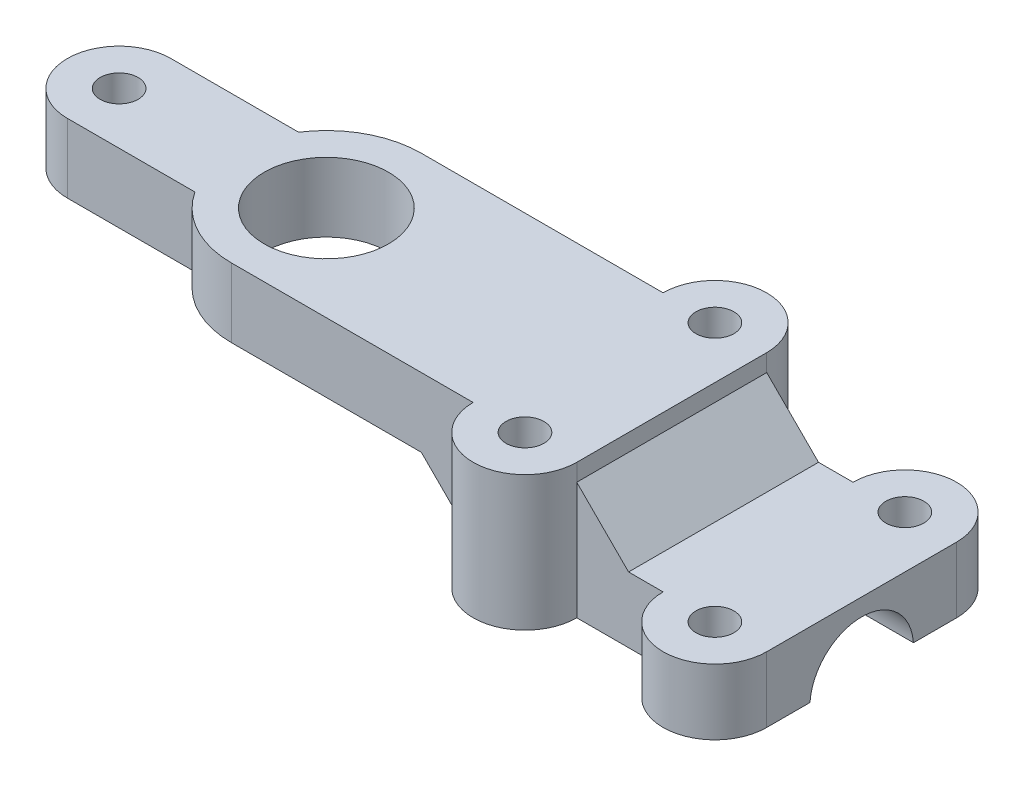
from build123d import *

# Parameters (mm, degrees)
SKETCH_1_R              = 3
SKETCH_1_R_2            = 1.1
SKETCH_1_R_3            = 5.5
SKETCH_1_R_4            = 3.6
EXTRUDE_1_DEPTH         = 4
EXTRUDE_START           = 4
SKETCH_2_R              = 1.1
EXTRUDE_2_DEPTH         = 4
CHAMFER_1_SIZE          = 3
SKETCH_3_R              = 3
CUT_EXTRUDE_1_DEPTH     = 12
SKETCH_4_R              = 1
CUT_EXTRUDE_2_DEPTH     = 12
CHAMFER_2_SIZE          = 0.2
CUT_EXTRUDE_START       = -0.2
CUT_EXTRUDE_3_OUTLINE_R = 1.1
CUT_EXTRUDE_3_DEPTH     = 0.2


with BuildPart() as part:
    # 草图1 → 凸台-拉伸1 (new body)
    # profile 1 of 12: a face of its own
    with BuildSketch(Plane(origin=(0, 0, 0), x_dir=(1, 0, 0), z_dir=(0, 1, 0))):
        Circle(SKETCH_1_R)
        with Locations(Location((0, 0, 0), (0, 0, 270))):
            Circle(SKETCH_1_R_2, mode=Mode.SUBTRACT)
    # profile 2 of 12: a face of its own
    with BuildSketch(Plane(origin=(0, 0, 0), x_dir=(1, 0, 0), z_dir=(0, 1, 0))):
        with BuildLine():
            Line((7.390227771, 3), (0, 3))
            ThreePointArc((0, 3), (2.121320344, 2.121320344), (3, 0))
            ThreePointArc((3, 0), (2.121320344, -2.121320344), (0, -3))
            Line((0, -3), (7.390227771, -3))
            ThreePointArc((7.390227771, -3), (6.5, 0), (7.390227771, 3))
        make_face()
    # profile 3 of 12: a face of its own
    with BuildSketch(Plane(origin=(0, 0, 0), x_dir=(1, 0, 0), z_dir=(0, 1, 0))):
        with Locations((12, 0)):
            Circle(SKETCH_1_R_3)
        with Locations(Location((12, 0, 0), (0, 0, 270))):
            Circle(SKETCH_1_R_4, mode=Mode.SUBTRACT)
    # profile 4 of 12: a face of its own
    with BuildSketch(Plane(origin=(0, 0, 0), x_dir=(1, 0, 0), z_dir=(0, 1, 0))):
        with BuildLine():
            Line((26, 5.5), (12, 5.5))
            ThreePointArc((12, 5.5), (15.889087297, 3.889087297), (17.5, 0))
            ThreePointArc((17.5, 0), (15.889087297, -3.889087297), (12, -5.5))
            Line((12, -5.5), (26, -5.5))
            ThreePointArc((26, -5.5), (29, -2.5), (32, -5.5))
            Line((32, -5.5), (32, 5.5))
            ThreePointArc((32, 5.5), (29, 2.5), (26, 5.5))
        make_face()
    # profile 5 of 12: a face of its own
    with BuildSketch(Plane(origin=(0, 0, 0), x_dir=(1, 0, 0), z_dir=(0, 1, 0))):
        with BuildLine():
            ThreePointArc((32, 5.5), (29, 8.5), (26, 5.5))
            Line((26, 5.5), (27.9, 5.5))
            ThreePointArc((27.9, 5.5), (29, 6.6), (30.1, 5.5))
            Line((30.1, 5.5), (32, 5.5))
        make_face()
    # profile 6 of 12: a face of its own
    with BuildSketch(Plane(origin=(0, 0, 0), x_dir=(1, 0, 0), z_dir=(0, 1, 0))):
        with BuildLine():
            Line((27.9, 5.5), (26, 5.5))
            ThreePointArc((26, 5.5), (29, 2.5), (32, 5.5))
            Line((32, 5.5), (30.1, 5.5))
            ThreePointArc((30.1, 5.5), (29, 4.4), (27.9, 5.5))
        make_face()
    # profile 7 of 12: a face of its own
    with BuildSketch(Plane(origin=(0, 0, 0), x_dir=(1, 0, 0), z_dir=(0, 1, 0))):
        with BuildLine():
            ThreePointArc((32, 5.5), (29, 8.5), (26, 5.5))
            Line((26, 5.5), (27.9, 5.5))
            ThreePointArc((27.9, 5.5), (29, 6.6), (30.1, 5.5))
            Line((30.1, 5.5), (32, 5.5))
        make_face()
    # profile 8 of 12: a face of its own
    with BuildSketch(Plane(origin=(0, 0, 0), x_dir=(1, 0, 0), z_dir=(0, 1, 0))):
        with BuildLine():
            Line((27.9, 5.5), (26, 5.5))
            ThreePointArc((26, 5.5), (29, 2.5), (32, 5.5))
            Line((32, 5.5), (30.1, 5.5))
            ThreePointArc((30.1, 5.5), (29, 4.4), (27.9, 5.5))
        make_face()
    # profile 9 of 12: a face of its own
    with BuildSketch(Plane(origin=(0, 0, 0), x_dir=(1, 0, 0), z_dir=(0, 1, 0))):
        with BuildLine():
            ThreePointArc((32, -5.5), (29, -2.5), (26, -5.5))
            Line((26, -5.5), (27.9, -5.5))
            ThreePointArc((27.9, -5.5), (29, -4.4), (30.1, -5.5))
            Line((30.1, -5.5), (32, -5.5))
        make_face()
    # profile 10 of 12: a face of its own
    with BuildSketch(Plane(origin=(0, 0, 0), x_dir=(1, 0, 0), z_dir=(0, 1, 0))):
        with BuildLine():
            Line((27.9, -5.5), (26, -5.5))
            ThreePointArc((26, -5.5), (29, -8.5), (32, -5.5))
            Line((32, -5.5), (30.1, -5.5))
            ThreePointArc((30.1, -5.5), (29, -6.6), (27.9, -5.5))
        make_face()
    # profile 11 of 12: a face of its own
    with BuildSketch(Plane(origin=(0, 0, 0), x_dir=(1, 0, 0), z_dir=(0, 1, 0))):
        with BuildLine():
            ThreePointArc((32, -5.5), (29, -2.5), (26, -5.5))
            Line((26, -5.5), (27.9, -5.5))
            ThreePointArc((27.9, -5.5), (29, -4.4), (30.1, -5.5))
            Line((30.1, -5.5), (32, -5.5))
        make_face()
    # profile 12 of 12: a face of its own
    with BuildSketch(Plane(origin=(0, 0, 0), x_dir=(1, 0, 0), z_dir=(0, 1, 0))):
        with BuildLine():
            Line((27.9, -5.5), (26, -5.5))
            ThreePointArc((26, -5.5), (29, -8.5), (32, -5.5))
            Line((32, -5.5), (30.1, -5.5))
            ThreePointArc((30.1, -5.5), (29, -6.6), (27.9, -5.5))
        make_face()
    extrude(amount=EXTRUDE_1_DEPTH)

    # 草图2 → 凸台-拉伸2 (add)
    # profile 1 of 3: a face of its own
    with BuildSketch(Plane.XZ.offset(EXTRUDE_START)):
        with BuildLine():
            Line((26, 5.5), (26, -5.5))
            ThreePointArc((26, -5.5), (29, -8.5), (32, -5.5))
            Line((32, -5.5), (32, 5.5))
            ThreePointArc((32, 5.5), (29, 8.5), (26, 5.5))
        make_face()
        with Locations(Location((29, 5.5, 0), (0, 0, 270))):
            Circle(SKETCH_2_R, mode=Mode.SUBTRACT)
        with Locations(Location((29, -5.5, 0), (0, 0, 270))):
            Circle(SKETCH_2_R, mode=Mode.SUBTRACT)
    # profile 2 of 3: a face of its own
    with BuildSketch(Plane.XZ.offset(EXTRUDE_START)):
        with BuildLine():
            Line((37, 5.5), (32, 5.5))
            Line((32, 5.5), (32, 0))
            Line((32, 0), (43, 0))
            Line((43, 0), (43, 5.5))
            ThreePointArc((43, 5.5), (40, 8.5), (37, 5.5))
        make_face()
        with Locations(Location((40, 5.5, 0), (0, 0, 270))):
            Circle(SKETCH_2_R, mode=Mode.SUBTRACT)
    # profile 3 of 3: a face of its own
    with BuildSketch(Plane.XZ.offset(EXTRUDE_START)):
        with BuildLine():
            Line((32, 0), (32, -5.5))
            Line((32, -5.5), (37, -5.5))
            ThreePointArc((37, -5.5), (40, -8.5), (43, -5.5))
            Line((43, -5.5), (43, 0))
            Line((43, 0), (32, 0))
        make_face()
        with Locations(Location((40, -5.5, 0), (0, 0, 270))):
            Circle(SKETCH_2_R, mode=Mode.SUBTRACT)
    extrude(amount=-EXTRUDE_2_DEPTH)

    # 倒角1
    chamfer_1_edges = [part.edges().sort_by_distance(p)[0] for p in [
        (32, 0, 0),
        (26, 0, 0),
    ]]
    chamfer(chamfer_1_edges, length=CHAMFER_1_SIZE)

    # 草图3 → 切除-拉伸1 (cut)
    with BuildSketch(Plane(origin=(43, 0, 0), x_dir=(0, 0, -1), z_dir=(1, 0, 0))):
        with Locations((0, -4)):
            Circle(SKETCH_3_R)
    extrude(amount=-CUT_EXTRUDE_1_DEPTH, mode=Mode.SUBTRACT)

    # 草图4 → 切除-拉伸2 (cut)
    with BuildSketch(Plane(origin=(31, 0, 0), x_dir=(0, 0, -1), z_dir=(1, 0, 0))):
        with Locations((0, -4)):
            Circle(SKETCH_4_R)
    extrude(amount=-CUT_EXTRUDE_2_DEPTH, mode=Mode.SUBTRACT)

    # 倒角2
    # the kernel refuses this chamfer: 0.2 mm, written as the material it takes off along each edge
    with BuildSketch(Plane(origin=(31, -4, 3), x_dir=(0, 0, 1), z_dir=(1, 0, 0)), Plane(origin=(43.53300923, -4, -3), x_dir=(0, 0, -1), z_dir=(-1, 0, 0))) as chamfer_2_piece_1:
        with BuildLine():
            Line((CHAMFER_2_SIZE, 0), (-0.007161172, -0.207161172))
            ThreePointArc((-0.007161172, -0.207161172), (-0.001893441, -0.106569522), (0, 0))
            Line((0, 0), (CHAMFER_2_SIZE, 0))
        make_face()
    extrude(amount=12.53300923, mode=Mode.SUBTRACT)
    with BuildSketch(Plane(origin=(31.584058146, -4, -1), x_dir=(0, 0.9935204423355923, 0.11365355542739984), z_dir=(-1, 0, 0))) as chamfer_2_piece_2:
        with BuildLine():
            Line((0.227307111, 0), (-CHAMFER_2_SIZE * 0.113653555427, CHAMFER_2_SIZE * 0.993520442336))
            Line((-CHAMFER_2_SIZE * 0.113653555427, CHAMFER_2_SIZE * 0.993520442336), (0, 0))
            ThreePointArc((0, 0), (0.116813439, 0.006474565), (0.227307111, 0))
        make_face()
    extrude(amount=6.168116293, mode=Mode.SUBTRACT)
    with BuildSketch(Plane(origin=(25.415941854, -4, 1), x_dir=(0, 0, 1), z_dir=(1, 0, 0))) as chamfer_2_piece_3:
        with BuildLine():
            Line((CHAMFER_2_SIZE, 0), (-0.025834261, -0.225834261))
            ThreePointArc((-0.025834261, -0.225834261), (-0.00684365, -0.116792397), (0, 0))
            Line((0, 0), (CHAMFER_2_SIZE, 0))
        make_face()
    extrude(amount=6.168116293, mode=Mode.SUBTRACT)

    # 切除-拉伸3: read off the stored shape, not the designer's step
    # 切除-拉伸3 outline → 切除-拉伸3 (cut)
    with BuildSketch(Plane.XZ.offset(4).offset(CUT_EXTRUDE_START)):
        with BuildLine():
            Line((26, 5.5), (26, -5.5))
            ThreePointArc((26, -5.5), (29, -8.5), (32, -5.5))
            Line((32, -5.5), (37, -5.5))
            ThreePointArc((37, -5.5), (40, -8.5), (43, -5.5))
            Line((43, -5.5), (43, 5.5))
            ThreePointArc((43, 5.5), (40, 8.5), (37, 5.5))
            Line((37, 5.5), (32, 5.5))
            ThreePointArc((32, 5.5), (29, 8.5), (26, 5.5))
        make_face()
        with Locations((29, -5.5)):
            Circle(CUT_EXTRUDE_3_OUTLINE_R, mode=Mode.SUBTRACT)
        with Locations((40, -5.5)):
            Circle(CUT_EXTRUDE_3_OUTLINE_R, mode=Mode.SUBTRACT)
        with Locations((29, 5.5)):
            Circle(CUT_EXTRUDE_3_OUTLINE_R, mode=Mode.SUBTRACT)
        with Locations((40, 5.5)):
            Circle(CUT_EXTRUDE_3_OUTLINE_R, mode=Mode.SUBTRACT)
    extrude(amount=CUT_EXTRUDE_3_DEPTH, mode=Mode.SUBTRACT)


solid = part.part
